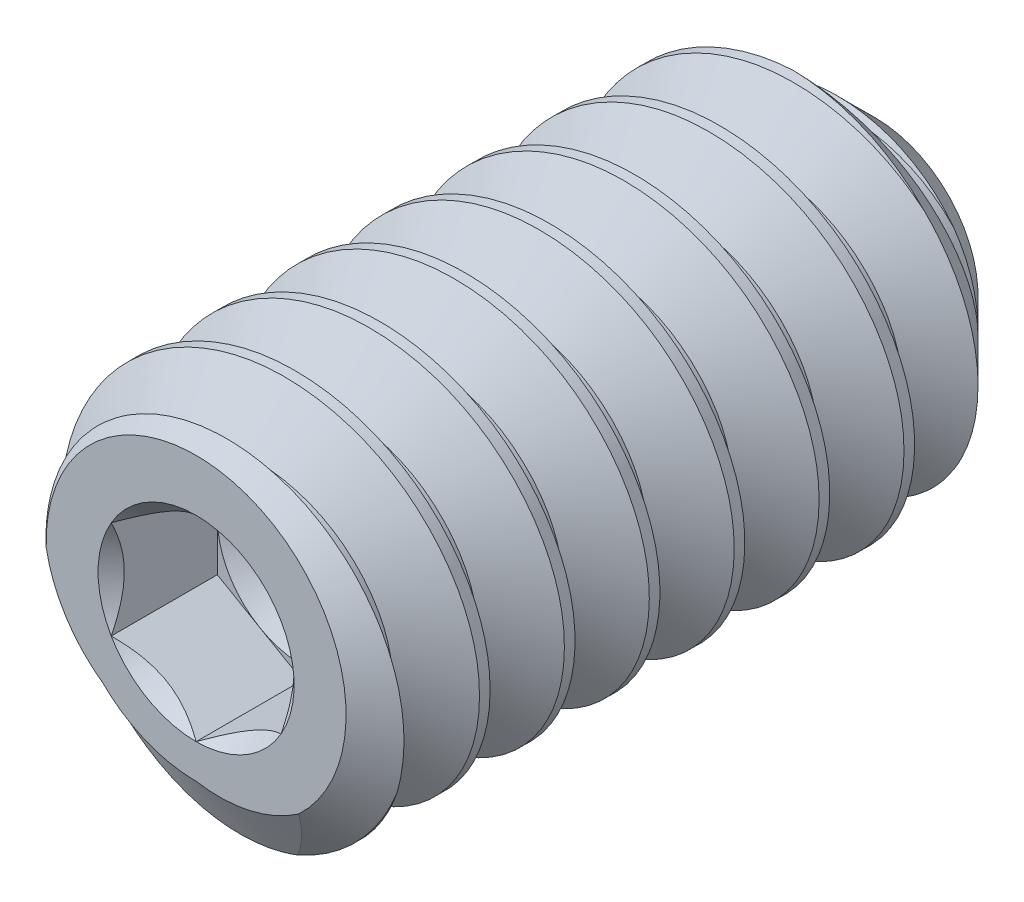
from build123d import *

# Parameters (mm, degrees)
CUT_EXTRUDE10_DEPTH = 0.9921875
CUT_SWEEP2_PITCH    = 0.79375


with BuildPart() as part:
    # Sketch22 → Revolve1 (revolve)
    with BuildSketch(Plane(origin=(0, 0, 0), x_dir=(0, 0, -1), z_dir=(1, 0, 0)), mode=Mode.PRIVATE) as revolve1_sk:
        Polygon((-2.886477758, 0), (-2.886477758, 1.40208), (-2.641041012, 1.7526), (2.671285537, 1.7526), (3.463522242, 0.960363295), (2.886477758, 0), align=None)
    revolve(revolve1_sk.sketch.rotate(Axis((0, 0, -2.886477758), (0, 0, -1)), 180), axis=Axis((0, 0, -2.886477758), (0, 0, -1)))

    # Sketch23 → Cut-Extrude10 (cut)
    with BuildSketch(Plane.XY.offset(2.886477758)):
        Polygon((0, 0.916543552), (-0.79375, 0.458271776), (-0.79375, -0.458271776), (0, -0.916543552), (0.79375, -0.458271776), (0.79375, 0.458271776), align=None)
    extrude(amount=-CUT_EXTRUDE10_DEPTH, mode=Mode.SUBTRACT)

    # Cut-Extrude11 cone 1 section (through the dimple's axis) → Cut-Extrude11 (revolve, cut)
    with BuildSketch(Plane(origin=(0, 0, 2.886477758), x_dir=(0, -1, 0), z_dir=(1, 0, 0))):
        Polygon((0, 0), (0.916543552, 0), (0, 0.916543552), align=None)
    revolve(axis=Axis((0, 0, 2.886477758), (0, 0, -1)), mode=Mode.SUBTRACT)

    # Cut-Extrude12 cone 1 section (through the dimple's axis) → Cut-Extrude12 (revolve, cut)
    with BuildSketch(Plane(origin=(0, 0, 1.894290258), x_dir=(0, -1, 0), z_dir=(1, 0, 0))):
        Polygon((0, 0), (0.79375, 0), (0, 0.458271776), align=None)
    revolve(axis=Axis((0, 0, 1.894290258), (0, 0, -1)), mode=Mode.SUBTRACT)

    # Cut-Sweep2: the profile of Sketch28 profile screwed along a right-hand helix of 9 turns, 8 arcs to a turn; built about Z, then put on its axis
    cut_sweep2_z = Axis((0, 0, 0), (0, 0, 1))
    cut_sweep2_corners = [(1.7529, 0, 0.000173205), (1.7529, 0, -0.694704455), (1.237044252, 0, -0.396875), (1.237044252, 0, -0.29765625)]
    with BuildLine(mode=Mode.PRIVATE) as cut_sweep2_profile:
        Line(cut_sweep2_corners[0], cut_sweep2_corners[1])
        Line(cut_sweep2_corners[1], cut_sweep2_corners[2])
        Line(cut_sweep2_corners[2], cut_sweep2_corners[3])
        Line(cut_sweep2_corners[3], cut_sweep2_corners[0])
    cut_sweep2_cap = Face(cut_sweep2_profile.wire())
    cut_sweep2_turn_angles = [0, 22.5, 45, 67.5, 90, 112.5, 135, 157.5, 180, 202.5, 225, 247.5, 270, 292.5, 315, 337.5, 360]
    cut_sweep2_turn_weights = [1, 0.9238795325112867, 1, 0.9238795325112867, 1, 0.9238795325112867, 1, 0.9238795325112867, 1, 0.9238795325112867, 1, 0.9238795325112867, 1, 0.9238795325112867, 1, 0.9238795325112867, 1]
    cut_sweep2_turn_rails = [Edge.make_bspline([Vector(p[0], p[1], 0).rotate(cut_sweep2_z, cut_sweep2_turn_angles[k]) / cut_sweep2_turn_weights[k] + Vector(0, 0, p[2] + CUT_SWEEP2_PITCH * cut_sweep2_turn_angles[k] / 360) for k in range(17)], [0, 0, 0, 1, 1, 2, 2, 3, 3, 4, 4, 5, 5, 6, 6, 7, 7, 8, 8, 8], 2, cut_sweep2_turn_weights) for p in cut_sweep2_corners]
    cut_sweep2_turn_sides = [Face.make_surface_from_curves(cut_sweep2_turn_rails[p[0]], cut_sweep2_turn_rails[p[1]]) for p in [(0, 1), (1, 2), (2, 3), (3, 0)]]
    cut_sweep2 = Plane(origin=(0, 0, -3.463522242), x_dir=(0, 1, 0), z_dir=(0, 0, 1)) * Solid(Shell([*[p.moved(Location((0, 0, CUT_SWEEP2_PITCH * i))) for i in range(9) for p in cut_sweep2_turn_sides], cut_sweep2_cap, cut_sweep2_cap.rotate(cut_sweep2_z, 3240).moved(Location((0, 0, CUT_SWEEP2_PITCH * 3240 / 360)))]))
    add(cut_sweep2, mode=Mode.SUBTRACT)


solid = part.part
